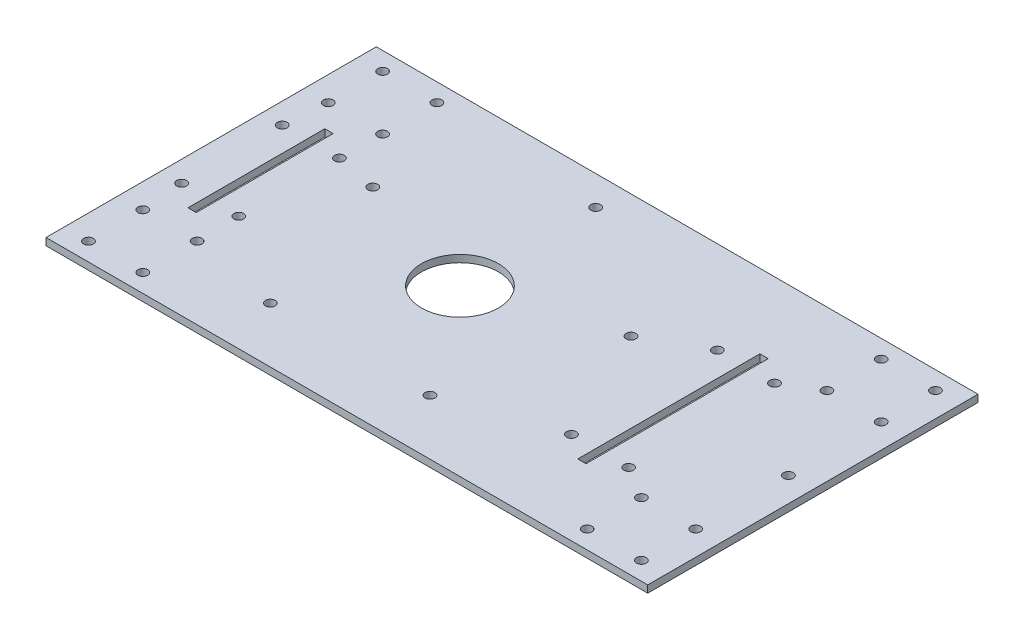
from build123d import *

# Parameters (mm, degrees)
SKETCH2_W           = 266
SKETCH2_H           = 146
SKETCH2_R           = 2.15
SKETCH2_R_2         = 17
SKETCH2_W_2         = 3.675
SKETCH2_H_2         = 80.5
SKETCH2_H_3         = 60.5
BOSS_EXTRUDE2_DEPTH = 3.175


with BuildPart() as part:
    # Sketch2 → Boss-Extrude2 (new body)
    with BuildSketch(Plane(origin=(0, 0, 0), x_dir=(1, 0, 0), z_dir=(0, 1, 0))):
        with Locations((133, 73)):
            Rectangle(SKETCH2_W, SKETCH2_H)
        with Locations((110, 133)):
            Circle(SKETCH2_R, mode=Mode.SUBTRACT)
        with Locations((167.063390978, 91.541019662)):
            Circle(SKETCH2_R, mode=Mode.SUBTRACT)
        with Locations((145.267115138, 24.458980338)):
            Circle(SKETCH2_R, mode=Mode.SUBTRACT)
        with Locations((74.732884862, 24.458980338)):
            Circle(SKETCH2_R, mode=Mode.SUBTRACT)
        with Locations((52.936609022, 91.541019662)):
            Circle(SKETCH2_R, mode=Mode.SUBTRACT)
        with Locations((10.8, 8)):
            Circle(SKETCH2_R, mode=Mode.SUBTRACT)
        with Locations((10.8, 138)):
            Circle(SKETCH2_R, mode=Mode.SUBTRACT)
        with Locations((34.8, 8)):
            Circle(SKETCH2_R, mode=Mode.SUBTRACT)
        with Locations((34.8, 138)):
            Circle(SKETCH2_R, mode=Mode.SUBTRACT)
        with Locations((9.2, 50.75)):
            Circle(SKETCH2_R, mode=Mode.SUBTRACT)
        with Locations((9.2, 95.25)):
            Circle(SKETCH2_R, mode=Mode.SUBTRACT)
        with Locations((34.475, 50.75)):
            Circle(SKETCH2_R, mode=Mode.SUBTRACT)
        with Locations((34.8, 32)):
            Circle(SKETCH2_R, mode=Mode.SUBTRACT)
        with Locations((34.8, 114)):
            Circle(SKETCH2_R, mode=Mode.SUBTRACT)
        with Locations((10.8, 32)):
            Circle(SKETCH2_R, mode=Mode.SUBTRACT)
        with Locations((10.8, 114)):
            Circle(SKETCH2_R, mode=Mode.SUBTRACT)
        with Locations((231.2, 138)):
            Circle(SKETCH2_R, mode=Mode.SUBTRACT)
        with Locations((231.2, 114)):
            Circle(SKETCH2_R, mode=Mode.SUBTRACT)
        with Locations((255.2, 114)):
            Circle(SKETCH2_R, mode=Mode.SUBTRACT)
        with Locations((255.2, 138)):
            Circle(SKETCH2_R, mode=Mode.SUBTRACT)
        with Locations((255.2, 73)):
            Circle(SKETCH2_R, mode=Mode.SUBTRACT)
        with Locations((231.2, 32)):
            Circle(SKETCH2_R, mode=Mode.SUBTRACT)
        with Locations((255.2, 32)):
            Circle(SKETCH2_R, mode=Mode.SUBTRACT)
        with Locations((231.2, 8)):
            Circle(SKETCH2_R, mode=Mode.SUBTRACT)
        with Locations((255.2, 8)):
            Circle(SKETCH2_R, mode=Mode.SUBTRACT)
        with Locations((110, 73)):
            Circle(SKETCH2_R_2, mode=Mode.SUBTRACT)
        with Locations((216.8, 40.75)):
            Circle(SKETCH2_R, mode=Mode.SUBTRACT)
        with Locations((216.8, 105.25)):
            Circle(SKETCH2_R, mode=Mode.SUBTRACT)
        with Locations((191.525, 40.75)):
            Circle(SKETCH2_R, mode=Mode.SUBTRACT)
        with Locations((191.525, 105.25)):
            Circle(SKETCH2_R, mode=Mode.SUBTRACT)
        with Locations((34.475, 95.25)):
            Circle(SKETCH2_R, mode=Mode.SUBTRACT)
        with Locations((204.1625, 73)):
            Rectangle(SKETCH2_W_2, SKETCH2_H_2, mode=Mode.SUBTRACT)
        with Locations((21.8375, 73)):
            Rectangle(SKETCH2_W_2, SKETCH2_H_3, mode=Mode.SUBTRACT)
    extrude(amount=BOSS_EXTRUDE2_DEPTH)


solid = part.part
